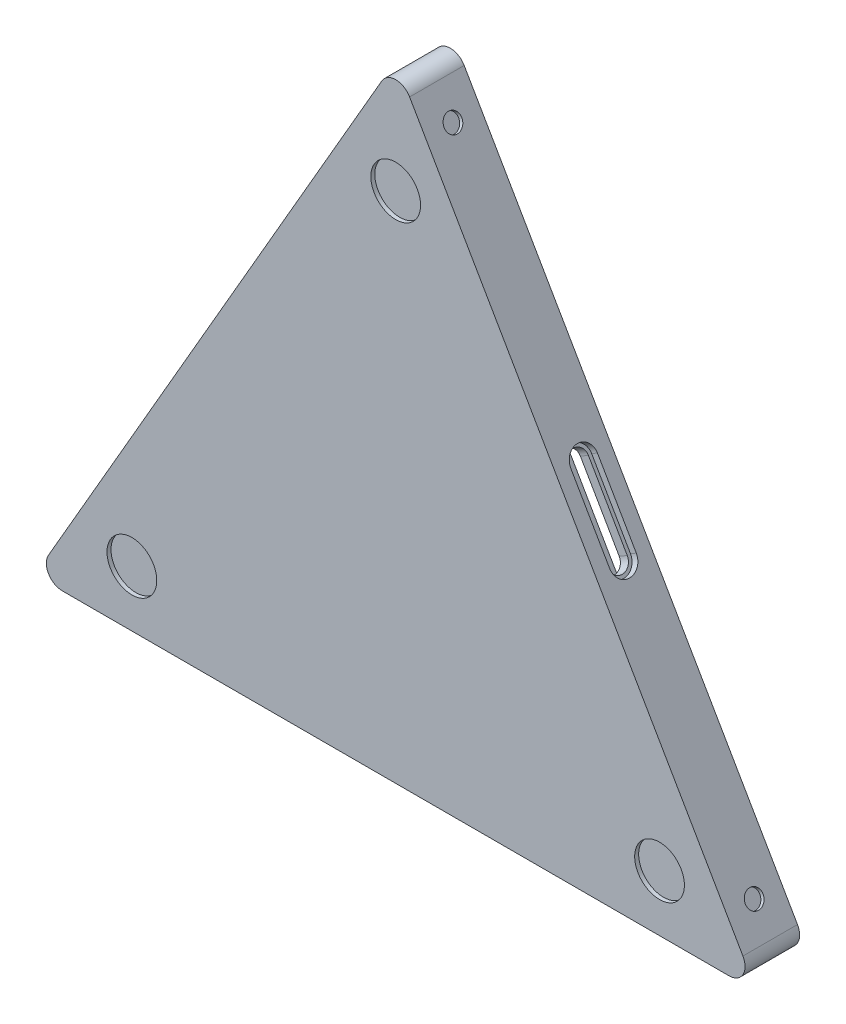
from build123d import *

# Parameters (mm, degrees)
BOSS_EXTRU_1_DEPTH      = 15
BOSS_EXTRU_2_DEPTH      = 2
ESQUISSE3_W             = 164.930853143
ESQUISSE3_H             = 1.4
BOSS_EXTRU_3_DEPTH      = 11
ENL_V_MAT_EXTRU_1_DEPTH = 2.1
ENL_V_MAT_EXTRU_2_REACH = 232.446
CONG_1_R                = 5
ESQUISSE6_R             = 7.75
ENL_V_MAT_EXTRU_3_DEPTH = 1.24
ESQUISSE7_R             = 2.75
ENL_V_MAT_EXTRU_4_DEPTH = 1.14
CONG_2_R                = 5
ENL_V_MAT_EXTRU_6_DEPTH = 2
ESQUISSE8_R             = 2.75
ENL_V_MAT_EXTRU_5_DEPTH = 4


with BuildPart() as part:
    # Esquisse1 → Boss.-Extru.1 (new body)
    with BuildSketch(Plane.XY):
        Polygon((-169.71822613, -51.377911564), (-57.21822613, 143.477804287), (55.28177387, -51.377911564), align=None)
        Polygon((46.621519833, -46.377911564), (-161.057972092, -46.377911564), (-57.21822613, 133.477804287), align=None, mode=Mode.SUBTRACT)
    extrude(amount=BOSS_EXTRU_1_DEPTH)

    # Esquisse2 → Boss.-Extru.2 (add)
    with BuildSketch(Plane.XY.offset(15)):
        Polygon((-57.21822613, 143.477804287), (-169.71822613, -51.377911564), (55.28177387, -51.377911564), align=None)
    extrude(amount=BOSS_EXTRU_2_DEPTH)

    # Esquisse3 → Boss.-Extru.3 (add)
    with BuildSketch(Plane(origin=(0, 0, 15), x_dir=(-1, 0, 0), z_dir=(0, 0, -1))):
        Polygon((53.949011072, 117.815357706), (-28.5164155, -25.018950984), (-27.303979934, -25.718950984), (55.161446637, 117.115357706), align=None)
        Polygon((149.019751584, -35.527102012), (147.807316018, -36.227102012), (65.341889447, 106.607206677), (66.554325012, 107.307206677), align=None)
        with Locations((51.042590893, -40.677911564)):
            Rectangle(ESQUISSE3_W, ESQUISSE3_H)
    extrude(amount=BOSS_EXTRU_3_DEPTH)

    # Esquisse4 → Enlèv. mat.-Extru.1 (cut)
    with BuildSketch(Plane(origin=(19.214042099, 11.093232378, 0), x_dir=(0, 0, -1), z_dir=(0.8660254037844387, 0.5000000000000001, 0))):
        with BuildLine():
            Line((-12.65, 52.464536457), (-12.65, 28.264536457))
            ThreePointArc((-12.65, 28.264536457), (-8.5, 24.114536457), (-4.35, 28.264536457))
            Line((-4.35, 28.264536457), (-4.35, 52.464536457))
            ThreePointArc((-4.35, 52.464536457), (-8.5, 56.614536457), (-12.65, 52.464536457))
        make_face()
    enl_v_mat_extru_1 = extrude(amount=-ENL_V_MAT_EXTRU_1_DEPTH, mode=Mode.SUBTRACT)

    # Esquisse5 → Enlèv. mat.-Extru.2 (cut, up to next)
    with BuildSketch(Plane(origin=(17.395388751, 10.043232378, 0), x_dir=(0, 0, -1), z_dir=(0.8660254037844386, 0.5000000000000003, 0)), mode=Mode.PRIVATE) as enl_v_mat_extru_2_sk1:
        with BuildLine():
            Line((-11.65, 52.464536457), (-11.65, 28.264536457))
            ThreePointArc((-11.65, 28.264536457), (-8.5, 25.114536457), (-5.35, 28.264536457))
            Line((-5.35, 28.264536457), (-5.35, 52.464536457))
            ThreePointArc((-5.35, 52.464536457), (-8.5, 55.614536457), (-11.65, 52.464536457))
        make_face()
    enl_v_mat_extru_2_tool1 = extrude(enl_v_mat_extru_2_sk1.sketch, amount=-ENL_V_MAT_EXTRU_2_REACH, mode=Mode.PRIVATE) & part.part
    enl_v_mat_extru_2 = enl_v_mat_extru_2_tool1.solids().sort_by_distance((-2.786879, 44.999946, 8.5))[0]
    add(enl_v_mat_extru_2, mode=Mode.SUBTRACT)

    # Congé1
    cong_1_edges = [part.edges().sort_by_distance(p)[0] for p in [
        (46.621519833, -46.377911564, 7.5),
        (-57.21822613, 133.477804287, 7.5),
        (-161.057972092, -46.377911564, 7.5),
        (-169.71822613, -51.377911564, 8.5),
        (-57.21822613, 143.477804287, 8.5),
        (55.28177387, -51.377911564, 8.5),
    ]]
    fillet(cong_1_edges, radius=CONG_1_R)

    # Symétrie1: Enlèv. mat.-Extru.1, Enlèv. mat.-Extru.2 across plane
    add(enl_v_mat_extru_1.mirror(Plane(origin=(-8.426844836, -14.595723404, 0), x_dir=(0, 0, 1), z_dir=(0.5000000000000001, 0.8660254037844386, 0))), mode=Mode.SUBTRACT)
    add(enl_v_mat_extru_2.mirror(Plane(origin=(-8.426844836, -14.595723404, 0), x_dir=(0, 0, 1), z_dir=(0.5000000000000001, 0.8660254037844386, 0))), mode=Mode.SUBTRACT)

    # Esquisse6 → Enlèv. mat.-Extru.3 (cut)
    with BuildSketch(Plane.XY.offset(17)):
        with Locations((-57.21822613, 108.477804287)):
            Circle(ESQUISSE6_R)
        with Locations(Location((-139.407336997, -33.877911564, 0), (0, 0, 180))):
            Circle(ESQUISSE6_R)
        with Locations((24.970884738, -33.877911564)):
            Circle(ESQUISSE6_R)
    extrude(amount=-ENL_V_MAT_EXTRU_3_DEPTH, mode=Mode.SUBTRACT)

    # Esquisse7 → Enlèv. mat.-Extru.4 (cut)
    with BuildSketch(Plane.XZ.offset(51.377911564)):
        with Locations((36.621519833, 8.5)):
            Circle(ESQUISSE7_R)
        with Locations(Location((-151.057972092, 8.5, 0), (0, 0, 180))):
            Circle(ESQUISSE7_R)
    enl_v_mat_extru_4 = extrude(amount=-ENL_V_MAT_EXTRU_4_DEPTH, mode=Mode.SUBTRACT)

    # Symétrie2: Enlèv. mat.-Extru.4 across plane
    add(enl_v_mat_extru_4.mirror(Plane(origin=(-8.426844836, -14.595723404, 0), x_dir=(0, 0, 1), z_dir=(0.5000000000000001, 0.8660254037844386, 0))), mode=Mode.SUBTRACT)

    # Symétrie3: Enlèv. mat.-Extru.4 across plane
    add(enl_v_mat_extru_4.mirror(Plane(origin=(-20.182268228, 34.956713983, 0), x_dir=(0, 0, 1), z_dir=(0.5000000000000001, -0.8660254037844387, 0))), mode=Mode.SUBTRACT)

    # Congé2
    cong_2_edges = [part.edges().sort_by_distance(p)[0] for p in [
        (-12.716297786, 46.398203361, 15),
        (-107.787038298, 35.890052333, 15),
        (-51.042590892, -41.377911564, 15),
    ]]
    fillet(cong_2_edges, radius=CONG_2_R - 0.0001)  # a hair under: the kernel refuses the full size

    # Esquisse9 → Enlèv. mat.-Extru.6 (cut)
    with BuildSketch(Plane(origin=(0, 0, 0), x_dir=(-1, 0, 0), z_dir=(0, 0, -1))):
        with BuildLine():
            Line((164.089061005, -44.627911564), (60.249315043, 135.227804287))
            ThreePointArc((60.249315043, 135.227804287), (57.21822613, 136.977804287), (54.187137216, 135.227804287))
            Line((54.187137216, 135.227804287), (-49.652608746, -44.627911564))
            ThreePointArc((-49.652608746, -44.627911564), (-49.652608746, -48.127911564), (-46.621519833, -49.877911564))
            Line((-46.621519833, -49.877911564), (161.057972092, -49.877911564))
            ThreePointArc((161.057972092, -49.877911564), (164.089061005, -48.127911564), (164.089061005, -44.627911564))
        make_face()
    extrude(amount=-ENL_V_MAT_EXTRU_6_DEPTH, mode=Mode.SUBTRACT)

    # Esquisse8 → Enlèv. mat.-Extru.5 (cut)
    with BuildSketch(Plane(origin=(0, 0, 0), x_dir=(-1, 0, 0), z_dir=(0, 0, -1))):
        with Locations((-45.914902423, -45.969945813)):
            Circle(ESQUISSE8_R)
        with Locations((57.21822613, 132.661872783)):
            Circle(ESQUISSE8_R)
        with Locations((160.351354682, -45.969945813)):
            Circle(ESQUISSE8_R)
    extrude(amount=-ENL_V_MAT_EXTRU_5_DEPTH, mode=Mode.SUBTRACT)


solid = part.part
